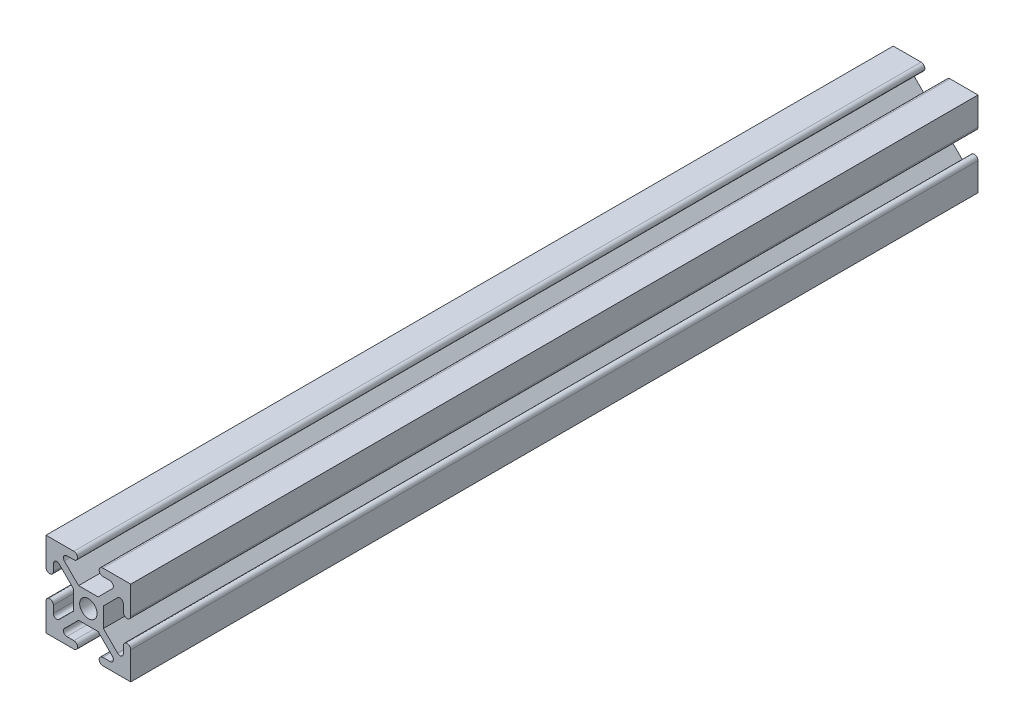
from build123d import *

# Parameters (mm, degrees)
SKETCH1_R           = 2.6035
BOSS_EXTRUDE1_DEPTH = 254


with BuildPart() as part:
    # Sketch1 → Boss-Extrude1 (new body)
    with BuildSketch(Plane.XY):
        with BuildLine():
            Line((-12.7, -12.7), (-4.343399971, -12.7))
            ThreePointArc((-4.343399971, -12.7), (-3.238499971, -11.5951), (-4.343399971, -10.4902))
            Line((-4.343399971, -10.4902), (-6.474794456, -10.4902))
            ThreePointArc((-6.474794456, -10.4902), (-7.413456061, -9.863006367), (-7.193214945, -8.75577951))
            Line((-7.193214945, -8.75577951), (-2.933235435, -4.4958))
            Line((-2.933235435, -4.4958), (2.933235435, -4.4958))
            Line((2.933235435, -4.4958), (7.193214945, -8.75577951))
            ThreePointArc((7.193214945, -8.75577951), (7.413456061, -9.863006367), (6.474794456, -10.4902))
            Line((6.474794456, -10.4902), (4.3434, -10.4902))
            ThreePointArc((4.3434, -10.4902), (3.2385, -11.5951), (4.3434, -12.7))
            Line((4.3434, -12.7), (12.7, -12.7))
            Line((12.7, -12.7), (12.7, -4.343399971))
            ThreePointArc((12.7, -4.343399971), (11.5951, -3.238499971), (10.4902, -4.343399971))
            Line((10.4902, -4.343399971), (10.4902, -6.474794456))
            ThreePointArc((10.4902, -6.474794456), (9.863006367, -7.413456061), (8.75577951, -7.193214945))
            Line((8.75577951, -7.193214945), (4.4958, -2.933235435))
            Line((4.4958, -2.933235435), (4.4958, 2.933235435))
            Line((4.4958, 2.933235435), (8.75577951, 7.193214945))
            ThreePointArc((8.75577951, 7.193214945), (9.863006367, 7.413456061), (10.4902, 6.474794456))
            Line((10.4902, 6.474794456), (10.4902, 4.3434))
            ThreePointArc((10.4902, 4.3434), (11.5951, 3.2385), (12.7, 4.3434))
            Line((12.7, 4.3434), (12.7, 12.7))
            Line((12.7, 12.7), (4.343399971, 12.7))
            ThreePointArc((4.343399971, 12.7), (3.238499971, 11.5951), (4.343399971, 10.4902))
            Line((4.343399971, 10.4902), (6.474794456, 10.4902))
            ThreePointArc((6.474794456, 10.4902), (7.413456061, 9.863006367), (7.193214945, 8.75577951))
            Line((7.193214945, 8.75577951), (2.933235435, 4.4958))
            Line((2.933235435, 4.4958), (-2.933235435, 4.4958))
            Line((-2.933235435, 4.4958), (-7.193214945, 8.75577951))
            ThreePointArc((-7.193214945, 8.75577951), (-7.413456061, 9.863006367), (-6.474794456, 10.4902))
            Line((-6.474794456, 10.4902), (-4.3434, 10.4902))
            ThreePointArc((-4.3434, 10.4902), (-3.2385, 11.5951), (-4.3434, 12.7))
            Line((-4.3434, 12.7), (-12.7, 12.7))
            Line((-12.7, 12.7), (-12.7, 4.343399971))
            ThreePointArc((-12.7, 4.343399971), (-11.5951, 3.238499971), (-10.4902, 4.343399971))
            Line((-10.4902, 4.343399971), (-10.4902, 6.474794456))
            ThreePointArc((-10.4902, 6.474794456), (-9.863006367, 7.413456061), (-8.75577951, 7.193214945))
            Line((-8.75577951, 7.193214945), (-4.4958, 2.933235435))
            Line((-4.4958, 2.933235435), (-4.4958, -2.933235435))
            Line((-4.4958, -2.933235435), (-8.75577951, -7.193214945))
            ThreePointArc((-8.75577951, -7.193214945), (-9.863006367, -7.413456061), (-10.4902, -6.474794456))
            Line((-10.4902, -6.474794456), (-10.4902, -4.3434))
            ThreePointArc((-10.4902, -4.3434), (-11.5951, -3.2385), (-12.7, -4.3434))
            Line((-12.7, -4.3434), (-12.7, -12.7))
        make_face()
        Circle(SKETCH1_R, mode=Mode.SUBTRACT)
    extrude(amount=-BOSS_EXTRUDE1_DEPTH)


solid = part.part
